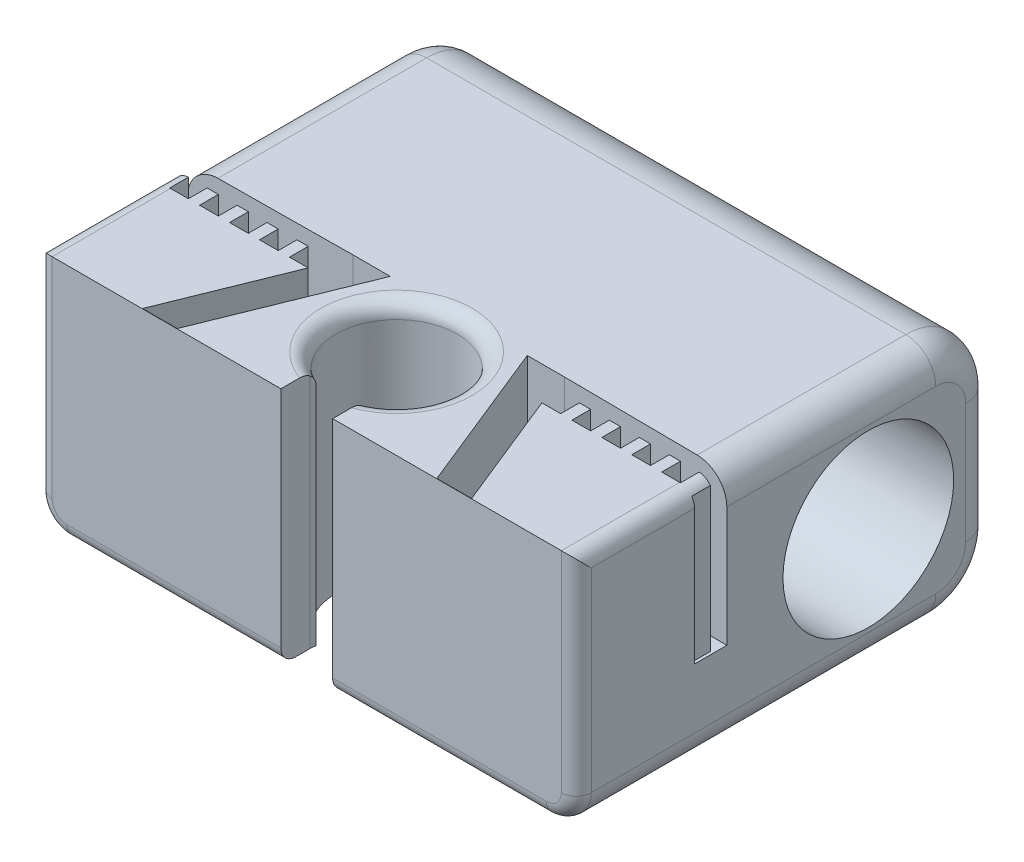
from build123d import *

# Parameters (mm, degrees)
SALIENTE_EXTRUIR1_DEPTH = 16
CROQUIS5_R              = 5.7
CORTAR_EXTRUIR1_DEPTH   = 38
SALIENTE_EXTRUIR2_DEPTH = 0.6
CORTAR_EXTRUIR2_DEPTH   = 10
REDONDEO1_R             = 4
REDONDEO2_R             = 2
REDONDEO3_R             = 1
REDONDEO5_R             = 1
SALIENTE_EXTRUIR3_START = -2
CROQUIS10_R             = 5.7
CROQUIS10_R_2           = 4.7
SALIENTE_EXTRUIR3_DEPTH = 2


with BuildPart() as part:
    # Croquis1 → Saliente-Extruir1 (new body)
    with BuildSketch(Plane(origin=(0, 0, 0), x_dir=(1, 0, 0), z_dir=(0, 1, 0))):
        with BuildLine():
            Line((-16.125, 9.1375), (19.875, 9.1375))
            Line((19.875, 9.1375), (19.875, -18.8625))
            Line((19.875, -18.8625), (3.603278106, -18.8625))
            Line((3.603278106, -18.8625), (3.603278106, -16.9125))
            ThreePointArc((3.603278106, -16.9125), (3.593299591, -16.727049938), (3.563479273, -16.543741332))
            ThreePointArc((3.563479273, -16.543741332), (1.875, -8.8125), (0.186520727, -16.543741332))
            ThreePointArc((0.186520727, -16.543741332), (0.156700409, -16.727049938), (0.146721894, -16.9125))
            Line((0.146721894, -16.9125), (0.146721894, -18.8625))
            Line((0.146721894, -18.8625), (-16.125, -18.8625))
            Line((-16.125, -18.8625), (-16.125, 9.1375))
        make_face()
    extrude(amount=SALIENTE_EXTRUIR1_DEPTH)

    # Croquis5 → Cortar-Extruir1 (cut)
    with BuildSketch(Plane(origin=(19.875, 0, 0), x_dir=(0, 0, -1), z_dir=(1, 0, 0))):
        with Locations((0.6375, 8)):
            Circle(CROQUIS5_R)
    extrude(amount=-CORTAR_EXTRUIR1_DEPTH, mode=Mode.SUBTRACT)

    # Croquis8 → Saliente-Extruir2 (add)
    with BuildSketch(Plane.XZ):
        with BuildLine():
            Line((-2.175, 12.8625), (5.925, 12.8625))
            ThreePointArc((5.925, 12.8625), (1.875, 8.8125), (-2.175, 12.8625))
        make_face()
    extrude(amount=-SALIENTE_EXTRUIR2_DEPTH)

    # Croquis9 → Cortar-Extruir2 (cut)
    with BuildSketch(Plane(origin=(0, 16, 0), x_dir=(1, 0, 0), z_dir=(0, 1, 0))):
        Polygon((-15.929202857, -9.7125), (-15.929202857, -10.9625), (-16.125, -10.9625), (-16.125, -8.8125), (-5.179202857, -8.7125), (-2.700687259, -8.7125), (-6.793467705, -18.842487075), (-9.112924295, -18.842487075), (-5.929202857, -10.9625), (-7.179202857, -10.9625), (-7.179202857, -9.7125), (-7.929202857, -9.7125), (-7.929202857, -10.9625), (-9.179202857, -10.9625), (-9.179202857, -9.7125), (-9.929202857, -9.7125), (-9.929202857, -10.9625), (-11.179202857, -10.9625), (-11.179202857, -9.7125), (-11.929202857, -9.7125), (-11.929202857, -10.9625), (-13.179202857, -10.9625), (-13.179202857, -9.7125), (-13.929202857, -9.7125), (-13.929202857, -10.9625), (-15.179202857, -10.9625), (-15.179202857, -9.7125), align=None)
        Polygon((12.862924295, -18.842487075), (10.543467705, -18.842487075), (6.450687259, -8.7125), (8.929202857, -8.7125), (19.875, -8.8125), (19.875, -10.9625), (19.679202857, -10.9625), (19.679202857, -9.7125), (18.929202857, -9.7125), (18.929202857, -10.9625), (17.679202857, -10.9625), (17.679202857, -9.7125), (16.929202857, -9.7125), (16.929202857, -10.9625), (15.679202857, -10.9625), (15.679202857, -9.7125), (14.929202857, -9.7125), (14.929202857, -10.9625), (13.679202857, -10.9625), (13.679202857, -9.7125), (12.929202857, -9.7125), (12.929202857, -10.9625), (11.679202857, -10.9625), (11.679202857, -9.7125), (10.929202857, -9.7125), (10.929202857, -10.9625), (9.679202857, -10.9625), align=None)
    extrude(amount=-CORTAR_EXTRUIR2_DEPTH, mode=Mode.SUBTRACT)

    # Redondeo1
    redondeo1_edges = [part.edges().sort_by_distance(p)[0] for p in [
        (1.875, 16, -9.1375),
        (1.875, 0, -9.1375),
    ]]
    fillet(redondeo1_edges, radius=REDONDEO1_R)

    # Redondeo2
    redondeo2_edges = [part.edges().sort_by_distance(p)[0] for p in [
        (-16.125, 16, 1.8375),
        (-16.125, 14.828427125, -7.965927125),
        (-16.125, 8, -9.1375),
        (-16.125, 1.171572875, -7.965927125),
        (19.875, 0, 6.8625),
        (19.875, 16, 1.8375),
        (-16.125, 0, 6.8625),
        (19.875, 1.171572875, -7.965927125),
        (19.875, 8, -9.1375),
        (19.875, 14.828427125, -7.965927125),
    ]]
    fillet(redondeo2_edges, radius=REDONDEO2_R)

    # Redondeo3
    redondeo3_edges = [part.edges().sort_by_distance(p)[0] for p in [
        (1.875, 16, 8.8125),
    ]]
    fillet(redondeo3_edges, radius=REDONDEO3_R)

    # Redondeo5
    redondeo5_edges = [part.edges().sort_by_distance(p)[0] for p in [
        (10.739139053, 0, 18.8625),
        (19.289213562, 0.585786438, 18.8625),
        (-6.989139053, 0, 18.8625),
        (-15.539213562, 0.585786438, 18.8625),
        (19.875, 9, 18.8625),
        (-16.125, 9, 18.8625),
        (-16.125, 16, 14.9125),
        (19.875, 16, 14.9125),
    ]]
    fillet(redondeo5_edges, radius=REDONDEO5_R)

    # Croquis10 → Saliente-Extruir3 (add)
    with BuildSketch(Plane.ZY.offset(16.125).offset(SALIENTE_EXTRUIR3_START)):
        with Locations((-0.6375, 8)):
            Circle(CROQUIS10_R)
        with Locations((-0.6375, 8)):
            Circle(CROQUIS10_R_2, mode=Mode.SUBTRACT)
    extrude(amount=SALIENTE_EXTRUIR3_DEPTH)


solid = part.part
